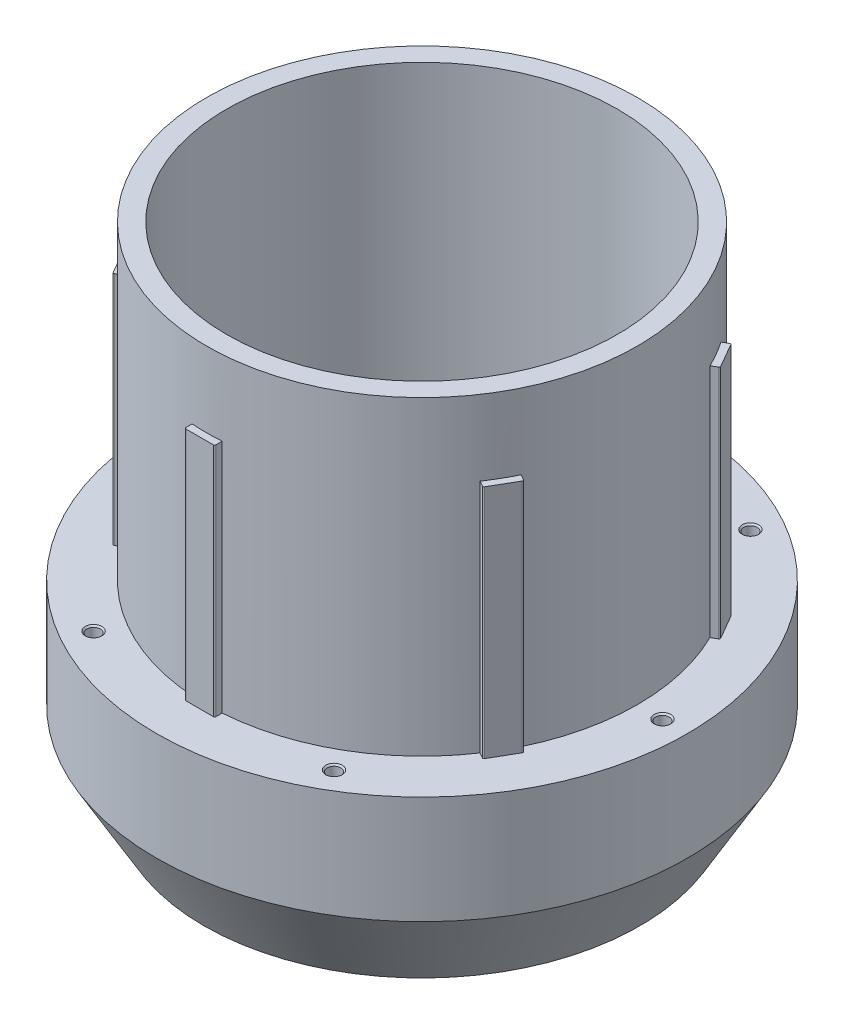
from build123d import *

# Parameters (mm, degrees)
DRIVING_EXTRUSION_DEPTH                    = 47
DRIVING_EXTRUSION_FILLETS_R                = 0.25
MAIN_PATTERN_COUNT                         = 6
DRIVING_EXTRUSION_FILLETS_OF_MAIN_PATTER_R = 0.25


with BuildPart() as part:
    # Sketch1 → body (revolve)
    with BuildSketch(Plane.XY):
        Polygon((40.5, -30), (43.5, -30), (53, -13.545517328), (53, 8), (43, 8), (43, 70), (39, 70), (39, 0), (40.5, 0), align=None)
    revolve(axis=Axis((0, 0, 0), (0, 1, 0)))

    # Sketch3 → spring_screw_hole (revolve, cut)
    with BuildSketch(Plane(origin=(48, 8, 0), x_dir=(0, 0, 1), z_dir=(1, 0, 0))):
        Polygon((0, 0), (0, 20.811161836), (1.35, 20), (1.35, 0.3), (1.65, 0), align=None)
    spring_screw_hole = revolve(axis=Axis((48, 14.35, 0), (0, -1, 0)), mode=Mode.SUBTRACT)

    # Sketch4 → driving_extrusion (add)
    with BuildSketch(Plane(origin=(0, 8, 0), x_dir=(1, 0, 0), z_dir=(0, 1, 0))):
        Polygon((35.64861562, 24.045294849), (38.648143991, 18.849959312), (39.947182097, 19.599959312), (36.947653726, 24.795294849), align=None)
    driving_extrusion = extrude(amount=DRIVING_EXTRUSION_DEPTH)

    # driving_extrusion_fillets
    driving_extrusion_fillets_edges = [part.edges().sort_by_distance(p)[0] for p in [
        (36.947653726, 31.5, -24.795294849),
        (39.947182097, 31.5, -19.599959312),
    ]]
    fillet(driving_extrusion_fillets_edges, radius=DRIVING_EXTRUSION_FILLETS_R)

    # main_pattern: spring_screw_hole, driving_extrusion ×6 about axis
    main_pattern_axis = Axis((0, 8, 0), (0, -1, 0))
    add([spring_screw_hole.rotate(main_pattern_axis, i * 360 / MAIN_PATTERN_COUNT) for i in range(1, MAIN_PATTERN_COUNT)], mode=Mode.SUBTRACT)
    add([driving_extrusion.rotate(main_pattern_axis, i * 360 / MAIN_PATTERN_COUNT) for i in range(1, MAIN_PATTERN_COUNT)])

    # driving_extrusion_fillets of main_patter
    driving_extrusion_fillets_of_main_patter_edges = [part.edges().sort_by_distance(p)[0] for p in [
        (39.947182097, 31.5, 19.599959312),
        (36.947653726, 31.5, 24.795294849),
        (2.999528371, 31.5, 44.395254161),
        (-2.999528371, 31.5, 44.395254161),
        (-36.947653726, 31.5, 24.795294849),
        (-39.947182097, 31.5, 19.599959312),
        (-39.947182097, 31.5, -19.599959312),
        (-36.947653726, 31.5, -24.795294849),
        (-2.999528371, 31.5, -44.395254161),
        (2.999528371, 31.5, -44.395254161),
    ]]
    fillet(driving_extrusion_fillets_of_main_patter_edges, radius=DRIVING_EXTRUSION_FILLETS_OF_MAIN_PATTER_R)


solid = part.part
